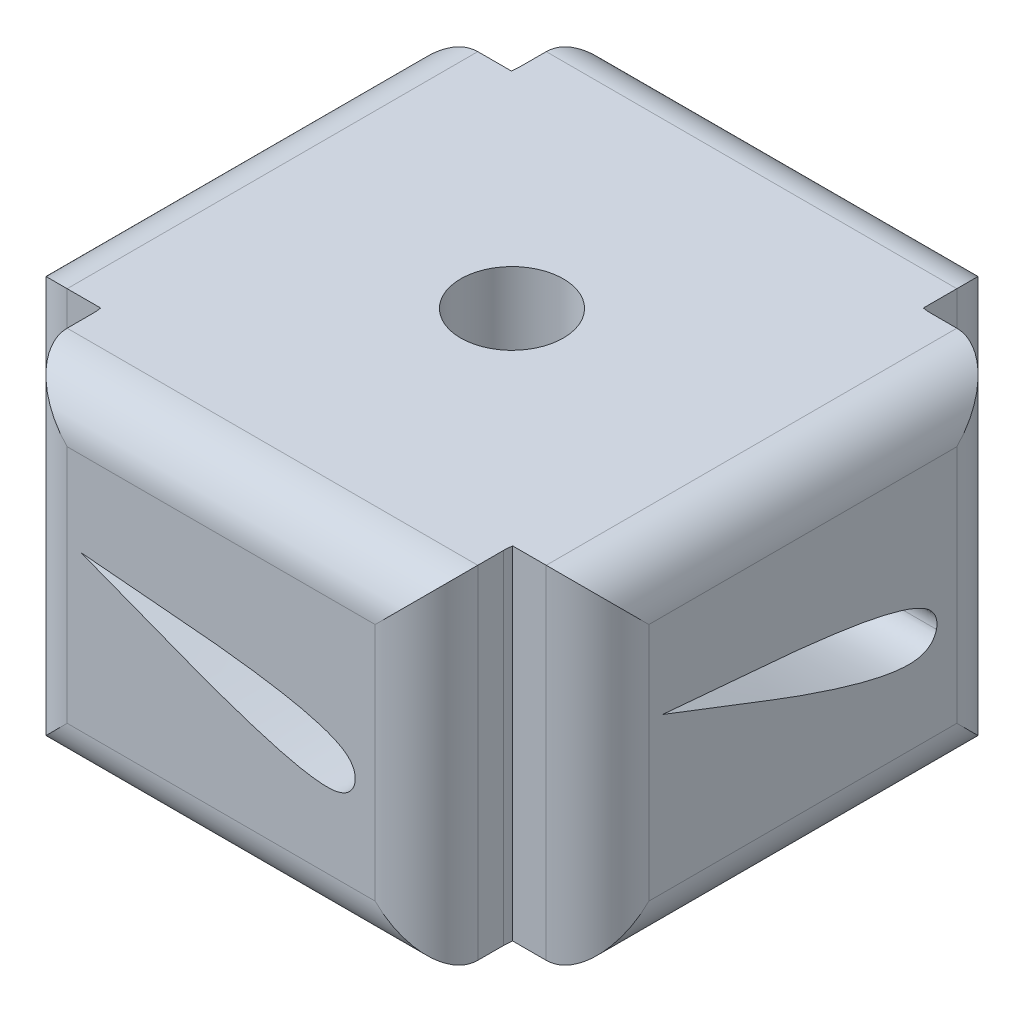
from build123d import *

# Parameters (mm, degrees)
ESQUISSE1_R                  = 17
ESQUISSE1_R_2                = 3
BOSS_EXTRU_1_DEPTH           = 20
BOSS_EXTRU_2_START           = -4.958405421
BOSS_EXTRU_2_OUTLINE_W       = 24
BOSS_EXTRU_2_OUTLINE_H       = 20
BOSS_EXTRU_2_DEPTH           = 4.958405421
R_P_TITION_CIRCULAIRE1_COUNT = 4
ENL_V_MAT_EXTRU_1_DEPTH      = 5
R_P_TITION_CIRCULAIRE2_COUNT = 4
CONG_1_R                     = 3


with BuildPart() as part:
    # Esquisse1 → Boss.-Extru.1 (new body)
    with BuildSketch(Plane(origin=(0, 0, 0), x_dir=(1, 0, 0), z_dir=(0, 1, 0))):
        with Locations(Location((0, 0, 0), (0, 0, 270))):
            Circle(ESQUISSE1_R)
        with Locations(Location((0, 0, 0), (0, 0, 270))):
            Circle(ESQUISSE1_R_2, mode=Mode.SUBTRACT)
    extrude(amount=BOSS_EXTRU_1_DEPTH)

    # Boss.-Extru.2: read off the stored shape, not the designer's step
    # Boss.-Extru.2 outline → Boss.-Extru.2 (add)
    with BuildSketch(Plane.XY.offset(17).offset(BOSS_EXTRU_2_START)):
        with Locations((0, 10)):
            Rectangle(BOSS_EXTRU_2_OUTLINE_W, BOSS_EXTRU_2_OUTLINE_H)
    boss_extru_2 = extrude(amount=BOSS_EXTRU_2_DEPTH)

    # Répétition circulaire1: Boss.-Extru.2 ×4 about axis
    r_p_tition_circulaire1_axis = Axis((0, 0, 0), (0, 1, 0))
    for i in range(1, R_P_TITION_CIRCULAIRE1_COUNT):
        add(boss_extru_2.rotate(r_p_tition_circulaire1_axis, i * 360 / R_P_TITION_CIRCULAIRE1_COUNT))

    # Esquisse4 → Enlèv. mat.-Extru.1 (cut)
    with BuildSketch(Plane.XY.offset(17)):
        with BuildLine():
            add(Edge.make_bspline(
                [(7.81, 8.349973898), (7.845016929, 8.501662122), (7.843654617, 8.846805541), (7.696751404, 9.18514572), (7.546127292, 9.390631529), (7.381250134, 9.557530695), (7.226689156, 9.679391685), (7.044897234, 9.794989784), (6.913380901, 9.867515976), (6.720225962, 9.967349744), (6.479301982, 10.072509753), (6.225062352, 10.169302013), (5.877977224, 10.289735152), (5.452497687, 10.416232173), (4.952800318, 10.544562522), (4.28677162, 10.695217805), (3.464566434, 10.851857223), (2.482527073, 11.009757235), (1.503846513, 11.146459181), (0.526828846, 11.266992429), (-0.783848935, 11.408467194), (-2.402070093, 11.54181636), (-4.33300906, 11.711432432), (-6.266889756, 11.878464677), (-7.555583225, 11.990311664), (-8.2, 12.046173638)],
                knots=[0.081729495, 0.081729495, 0.081729495, 0.081729495, 0.085316489, 0.088903484, 0.092490478, 0.096077472, 0.10325146, 0.110425449, 0.117599437, 0.124773425, 0.139121402, 0.153469378, 0.167817355, 0.196513308, 0.225209262, 0.253905215, 0.311297121, 0.368689028, 0.426080935, 0.483472841, 0.540864748, 0.655648561, 0.770432374, 0.885216187, 1, 1, 1, 1], degree=3))
            add(Edge.make_bspline(
                [(-8.2, 12.046173638), (-7.596326539, 11.813858719), (-6.389059736, 11.349405014), (-4.577678814, 10.651667651), (-2.767980405, 9.957629107), (-1.25469062, 9.367814929), (-0.014942254, 8.920675199), (0.916199686, 8.600665462), (1.855721354, 8.294561412), (2.807613901, 8.006017649), (3.615263802, 7.78639928), (4.279964162, 7.629873725), (4.785293813, 7.526173164), (5.223285817, 7.453373867), (5.587861324, 7.409477893), (5.859382183, 7.385039429), (6.120400909, 7.373955903), (6.337576436, 7.378758848), (6.489416814, 7.386356769), (6.70416335, 7.411009967), (6.895225091, 7.452563296), (7.116839622, 7.530334781), (7.342608744, 7.649141627), (7.623168783, 7.889590024), (7.775042154, 8.198541617), (7.81, 8.349973898)],
                knots=[0, 0, 0, 0, 0.114784452, 0.229568904, 0.344353356, 0.459137808, 0.516530034, 0.57392226, 0.631314486, 0.688706712, 0.746098939, 0.774795052, 0.803491165, 0.832187278, 0.846535334, 0.860883391, 0.875231447, 0.882405475, 0.889579504, 0.896753532, 0.90392756, 0.907514574, 0.911101588, 0.914688603, 0.918275617, 0.918275617, 0.918275617, 0.918275617], degree=3))
        make_face()
    enl_v_mat_extru_1 = extrude(amount=-ENL_V_MAT_EXTRU_1_DEPTH, mode=Mode.SUBTRACT)

    # Répétition circulaire2: Enlèv. mat.-Extru.1 ×4 about axis
    r_p_tition_circulaire2_axis = Axis((0, 51.695441496, 0), (0, -1, 0))
    for i in range(1, R_P_TITION_CIRCULAIRE2_COUNT):
        add(enl_v_mat_extru_1.rotate(r_p_tition_circulaire2_axis, i * 360 / R_P_TITION_CIRCULAIRE2_COUNT), mode=Mode.SUBTRACT)

    # Congé1
    # the kernel refuses this fillet: 3 mm, written as the material it adds along each edge
    with BuildSketch(Plane(origin=(12, 0, 12.041594579), x_dir=(0, 0, 1), z_dir=(0, 1, 0)), Plane(origin=(-12, 0, -12.041594579), x_dir=(0, 0, -1), z_dir=(0, 1, 0)), Plane(origin=(12.041594579, 0, -12), x_dir=(1, 0, 0), z_dir=(0, 1, 0))) as cong_1_piece_1:
        with BuildLine():
            CenterArc((0.456238089, 3), CONG_1_R, 260.44790934, 9.55209066)
            ThreePointArc((-0.041594579, 0.041594579), (-0.020779299, 0.02081528), (0, 0))
            Line((0, 0), (0.456238089, 0))
        make_face()
    extrude(amount=20)
    with BuildSketch(Plane(origin=(-12, 20, 12.041594579), x_dir=(-0.70710678118694, 0, -0.7071067811861549), z_dir=(0, -1, 0))) as cong_1_piece_2:
        with BuildLine():
            CenterArc((1.798711297, -2.44392939), CONG_1_R, 125.44790934, 9.55209066)
            Line((-0.322609046, -0.322609046), (0, 0))
            ThreePointArc((0, 0), (0.029411809, -2.5443e-05), (0.058823618, 0))
        make_face()
    extrude(amount=20)
    # the kernel refuses this fillet: 3 mm, written as the material it takes off along each edge
    with BuildSketch(Plane(origin=(19.5, 0, 17), x_dir=(0, 0, -1), z_dir=(-1, 0, 0)), Plane(origin=(19.5, 20, 17), x_dir=(0, -1, 0), z_dir=(-1, 0, 0)), Plane(origin=(-17, 0, 19.5), x_dir=(1, 0, 0), z_dir=(0, 0, -1)), Plane(origin=(-19.5, 0, -17), x_dir=(0, 0, 1), z_dir=(1, 0, 0)), Plane(origin=(17, 0, -19.5), x_dir=(-1, 0, 0), z_dir=(0, 0, 1))) as cong_1_2_piece_1:
        with BuildLine():
            CenterArc((CONG_1_R, -CONG_1_R), CONG_1_R, 90, 90)
            Line((0, -CONG_1_R), (0, 0))
            Line((0, 0), (CONG_1_R, 0))
        make_face()
    extrude(amount=39, mode=Mode.SUBTRACT)
    with BuildSketch(Plane(origin=(12, -7.5, 17), x_dir=(-1, 0, 0), z_dir=(0, 1, 0)), Plane(origin=(-17, -7.5, 12), x_dir=(0, 0, -1), z_dir=(0, 1, 0)), Plane(origin=(-12, -7.5, -17), x_dir=(1, 0, 0), z_dir=(0, 1, 0))) as cong_1_2_piece_2:
        with BuildLine():
            CenterArc((CONG_1_R, -CONG_1_R), CONG_1_R, 90, 90)
            Line((0, -CONG_1_R), (0, 0))
            Line((0, 0), (CONG_1_R, 0))
        make_face()
    extrude(amount=35, mode=Mode.SUBTRACT)
    with BuildSketch(Plane(origin=(-12, 27.5, 17), x_dir=(0, 0, -1), z_dir=(0, -1, 0)), Plane(origin=(-17, 27.5, -12), x_dir=(1, 0, 0), z_dir=(0, -1, 0)), Plane(origin=(12, 27.5, -17), x_dir=(0, 0, 1), z_dir=(0, -1, 0)), Plane(origin=(17, 27.5, 12), x_dir=(-1, 0, 0), z_dir=(0, -1, 0)), Plane(origin=(17, -7.5, -12), x_dir=(-1, 0, 0), z_dir=(0, 1, 0))) as cong_1_2_piece_3:
        with BuildLine():
            CenterArc((CONG_1_R, CONG_1_R), CONG_1_R, 180, 90)
            Line((0, CONG_1_R), (0, 0))
            Line((0, 0), (CONG_1_R, 0))
        make_face()
    extrude(amount=35, mode=Mode.SUBTRACT)
    with BuildSketch(Plane(origin=(-17, 20, -19.5), x_dir=(0, -1, 0), z_dir=(0, 0, 1)), Plane(origin=(19.5, 20, -17), x_dir=(0, -1, 0), z_dir=(-1, 0, 0)), Plane(origin=(17, 20, 19.5), x_dir=(0, -1, 0), z_dir=(0, 0, -1))) as cong_1_2_piece_4:
        with BuildLine():
            CenterArc((CONG_1_R, CONG_1_R), CONG_1_R, 180, 90)
            Line((0, CONG_1_R), (0, 0))
            Line((0, 0), (CONG_1_R, 0))
        make_face()
    extrude(amount=39, mode=Mode.SUBTRACT)


solid = part.part
